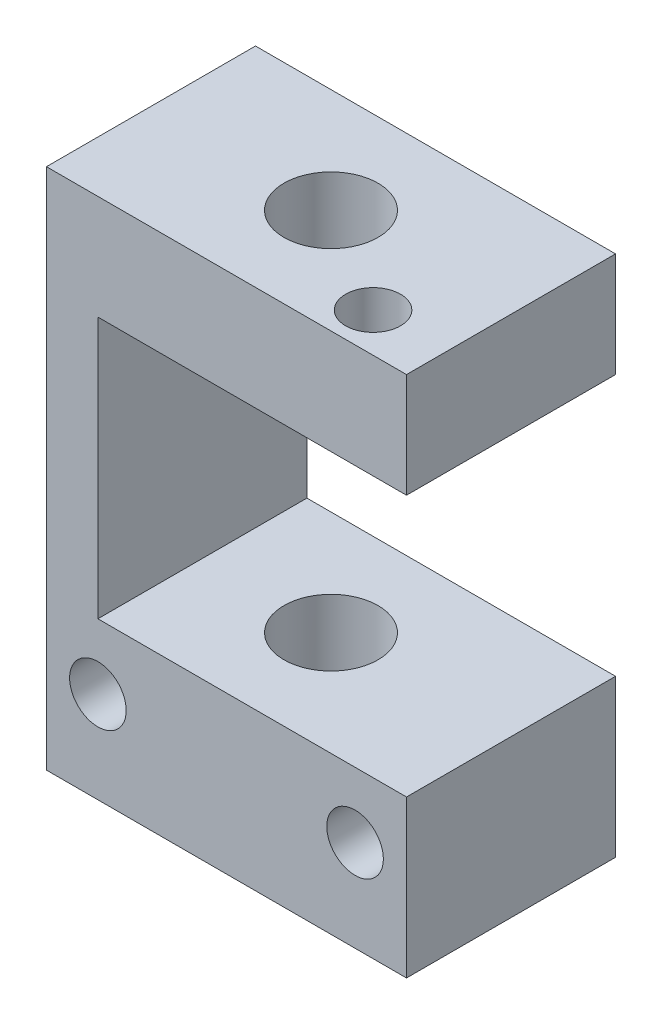
from build123d import *

# Parameters (mm, degrees)
SKETCH2_W            = 35
SKETCH2_H            = 20.32
SKETCH2_R            = 4.572
BOSS_EXTRUDE1_DEPTH  = 50.8
M5_CLEARANCE_HOLE1_D = 5.5
SKETCH7_R            = 2.667
CUT_EXTRUDE1_DEPTH   = 5
SKETCH8_W            = 30
SKETCH8_H            = 25.4
CUT_EXTRUDE2_DEPTH   = 65.950307159


with BuildPart() as part:
    # Sketch2 → Boss-Extrude1 (new body)
    with BuildSketch(Plane(origin=(0, 0, 0), x_dir=(1, 0, 0), z_dir=(0, 1, 0))):
        with Locations((17.5, 10.16)):
            Rectangle(SKETCH2_W, SKETCH2_H)
        with Locations((17.5, 10.16)):
            Circle(SKETCH2_R, mode=Mode.SUBTRACT)
    extrude(amount=BOSS_EXTRUDE1_DEPTH)

    # M5 Clearance Hole1 (through all)
    with Locations(Plane.XY):
        with Locations((5, 8.89), (30, 8.89)):
            Hole(M5_CLEARANCE_HOLE1_D / 2)

    # Sketch7 → Cut-Extrude1 (cut)
    with BuildSketch(Plane(origin=(0, 50.8, 0), x_dir=(1, 0, 0), z_dir=(0, 1, 0))):
        with Locations((27.94, 3.81)):
            Circle(SKETCH7_R)
    extrude(amount=-CUT_EXTRUDE1_DEPTH, mode=Mode.SUBTRACT)

    # Sketch8 → Cut-Extrude2 (cut, through all)
    with BuildSketch(Plane(origin=(0, 0, -20.32), x_dir=(-1, 0, 0), z_dir=(0, 0, -1))):
        with Locations((-20, 27.94)):
            Rectangle(SKETCH8_W, SKETCH8_H)
    extrude(amount=-CUT_EXTRUDE2_DEPTH, mode=Mode.SUBTRACT)


solid = part.part
